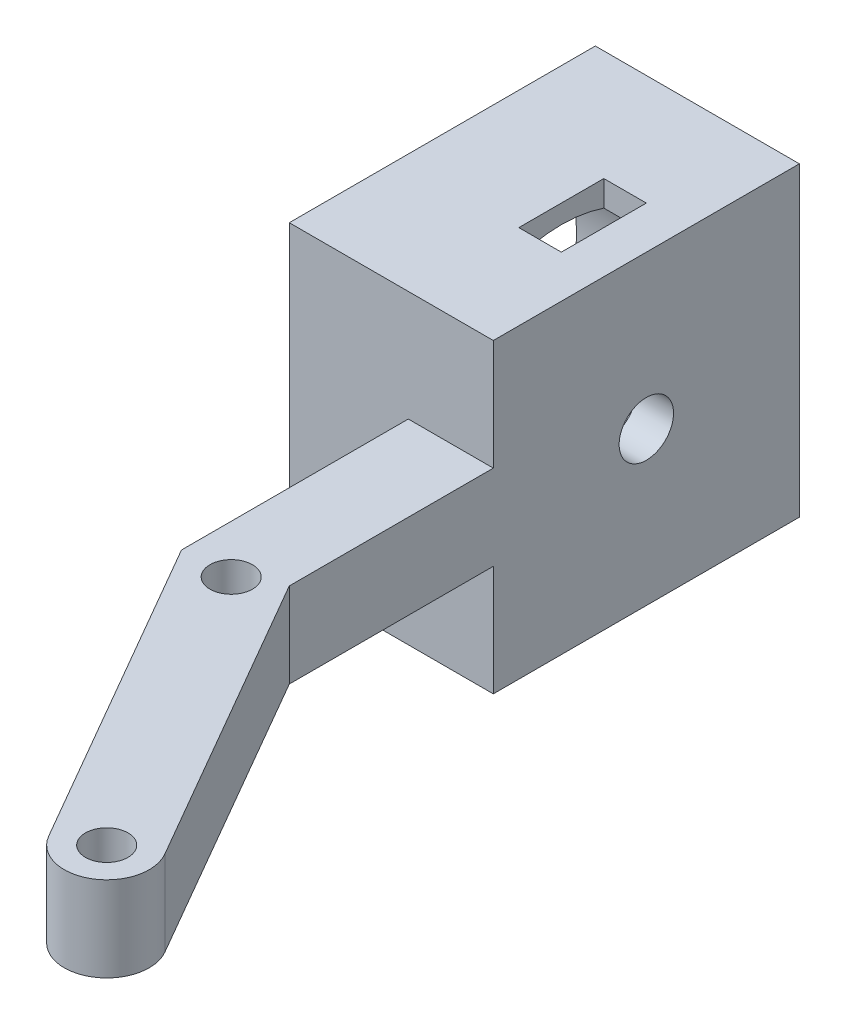
from build123d import *

# Parameters (mm, degrees)
SKETCH1_R               = 1.5875
BOSS_EXTRUDE1_DEPTH     = 22.86
TOP_CUT_DEPTH           = 8.255
BOTTOM_CUT_DEPTH        = 8.255
SKETCH5_R               = 10.033
CUT_EXTRUDE1_DEPTH      = 12.446
SKETCH7_R               = 2.032
CUT_EXTRUDE2_DEPTH      = 49.082147538
CUT_EXTRUDE3_REACH      = 50.082
CUT_EXTRUDE3_END_RADIUS = 10.033
SKETCH8_W               = 3.175
SKETCH8_H               = 6.35


with BuildPart() as part:
    # Sketch1 → Boss-Extrude1 (new body)
    with BuildSketch(Plane(origin=(0, 0, 0), x_dir=(1, 0, 0), z_dir=(0, 1, 0))):
        with BuildLine():
            Line((-6.35, -14.401477372), (-6.35, 2.54))
            Line((-6.35, 2.54), (-15.24, 2.54))
            Line((-15.24, 2.54), (-15.24, 25.4))
            Line((-15.24, 25.4), (0, 25.4))
            Line((0, 25.4), (0, -12.7))
            Line((0, -12.7), (12.7, -34.697045256))
            ThreePointArc((12.7, -34.697045256), (11.537869343, -39.034175913), (7.200738686, -37.872045256))
            Line((7.200738686, -37.872045256), (-6.35, -14.401477372))
        make_face()
        with Locations((9.950369343, -36.284545256)):
            Circle(SKETCH1_R, mode=Mode.SUBTRACT)
        with Locations((-2.749630657, -14.2875)):
            Circle(SKETCH1_R, mode=Mode.SUBTRACT)
    extrude(amount=BOSS_EXTRUDE1_DEPTH)

    # Sketch2 → Top Cut (cut)
    with BuildSketch(Plane(origin=(0, 22.86, 0), x_dir=(1, 0, 0), z_dir=(0, 1, 0))):
        Polygon((-6.35, -14.401477372), (8.788238686, -40.621675913), (14.2875, -37.446675913), (0, -12.7), (0, 2.54), (-6.35, 2.54), align=None)
    extrude(amount=-TOP_CUT_DEPTH, mode=Mode.SUBTRACT)

    # Sketch4 → Bottom Cut (cut)
    with BuildSketch(Plane.XZ):
        Polygon((-6.35, -2.54), (-6.35, 14.401477372), (8.788238686, 40.621675913), (14.2875, 37.446675913), (0, 12.7), (0, -2.54), align=None)
    extrude(amount=-BOTTOM_CUT_DEPTH, mode=Mode.SUBTRACT)

    # Sketch5 → Cut-Extrude1 (cut)
    with BuildSketch(Plane.ZY.offset(15.24)):
        with Locations((-13.97, 11.43)):
            Circle(SKETCH5_R)
    extrude(amount=-CUT_EXTRUDE1_DEPTH, mode=Mode.SUBTRACT)

    # Sketch7 → Cut-Extrude2 (cut, through all)
    with BuildSketch(Plane(origin=(0, 0, 0), x_dir=(0, 0, -1), z_dir=(1, 0, 0))):
        with Locations((13.97, 11.43)):
            Circle(SKETCH7_R)
    extrude(amount=-CUT_EXTRUDE2_DEPTH, mode=Mode.SUBTRACT)

    # Cut-Extrude3: up to this cylinder (the profile starts outside it)
    cut_extrude3_end = Plane(origin=(-4.7625, 11.43, -13.97), z_dir=(-1, 0, 0)) * Cylinder(CUT_EXTRUDE3_END_RADIUS, 121.23, mode=Mode.PRIVATE)
    # Sketch8 → Cut-Extrude3 (cut, up to the surface)
    with BuildSketch(Plane(origin=(0, 22.86, 0), x_dir=(1, 0, 0), z_dir=(0, 1, 0)), mode=Mode.PRIVATE) as cut_extrude3_sk1:
        with Locations((-4.7625, 13.97)):
            Rectangle(SKETCH8_W, SKETCH8_H)
    cut_extrude3_tool1 = extrude(cut_extrude3_sk1.sketch, amount=-CUT_EXTRUDE3_REACH, mode=Mode.PRIVATE) - cut_extrude3_end
    add(cut_extrude3_tool1.solids().sort_by_distance((-4.7625, 22.86, -13.97))[0], mode=Mode.SUBTRACT)


solid = part.part
